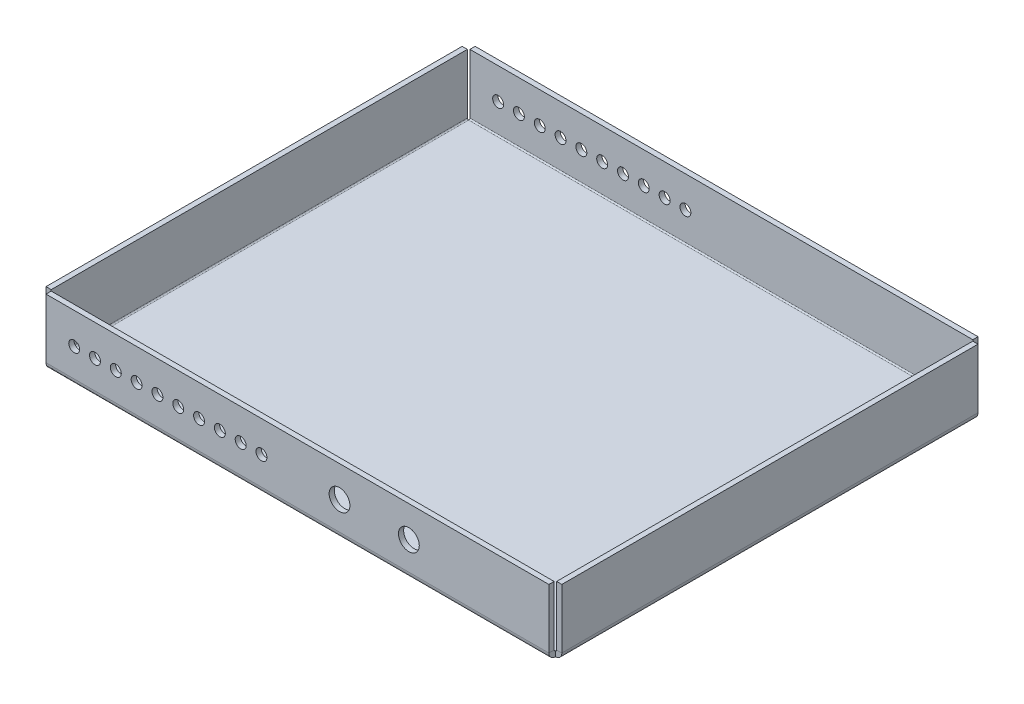
from build123d import *

# Parameters (mm, degrees)
SKETCH15_W         = 290
SKETCH15_H         = 240
BASE_FLANGE1_DEPTH = 3
EDGE_FLANGE1_DEPTH = 240
EDGE_FLANGE2_DEPTH = 290
EDGE_FLANGE3_DEPTH = 240
EDGE_FLANGE4_DEPTH = 290
SKETCH32_R         = 3.15
CUT_EXTRUDE3_DEPTH = 386.680145843
SKETCH33_R         = 6
CUT_EXTRUDE4_DEPTH = 10


# Sheet-metal steps are written as plain solids
with BuildPart() as part:
    # Sketch15 → Base-Flange1 (new body)
    with BuildSketch(Plane(origin=(0, 0, 0), x_dir=(1, 0, 0), z_dir=(0, 1, 0))):
        with Locations((145, 120)):
            Rectangle(SKETCH15_W, SKETCH15_H)
    extrude(amount=-BASE_FLANGE1_DEPTH)

    # Edge-Flange1 section (across the edge) → Edge-Flange1 (add)
    with BuildSketch(Plane(origin=(-0.7366, 0, -240), x_dir=(1, 0, 0), z_dir=(0, 0, 1))):
        with BuildLine():
            Line((-3, 0.7366), (-3, 35))
            Line((-3, 35), (0, 35))
            Line((0, 35), (0, 0.7366))
            ThreePointArc((0, 0.7366), (0.215745145, 0.215745145), (0.7366, 0))
            Line((0.7366, 0), (0.7366, -3))
            ThreePointArc((0.7366, -3), (-1.905575199, -1.905575199), (-3, 0.7366))
        make_face()
    extrude(amount=EDGE_FLANGE1_DEPTH)

    # Edge-Flange2 section (across the edge) → Edge-Flange2 (add)
    with BuildSketch(Plane(origin=(0, 0, 0.7366), x_dir=(0, 0, -1), z_dir=(1, 0, 0))):
        with BuildLine():
            Line((-3, 0.7366), (-3, 35))
            Line((-3, 35), (0, 35))
            Line((0, 35), (0, 0.7366))
            ThreePointArc((0, 0.7366), (0.215745145, 0.215745145), (0.7366, 0))
            Line((0.7366, 0), (0.7366, -3))
            ThreePointArc((0.7366, -3), (-1.905575199, -1.905575199), (-3, 0.7366))
        make_face()
    extrude(amount=EDGE_FLANGE2_DEPTH)

    # Edge-Flange3 section (across the edge) → Edge-Flange3 (add)
    with BuildSketch(Plane(origin=(290.7366, 0, 0), x_dir=(-1, 0, 0), z_dir=(0, 0, -1))):
        with BuildLine():
            Line((-3, 0.7366), (-3, 35))
            Line((-3, 35), (0, 35))
            Line((0, 35), (0, 0.7366))
            ThreePointArc((0, 0.7366), (0.215745145, 0.215745145), (0.7366, 0))
            Line((0.7366, 0), (0.7366, -3))
            ThreePointArc((0.7366, -3), (-1.905575199, -1.905575199), (-3, 0.7366))
        make_face()
    extrude(amount=EDGE_FLANGE3_DEPTH)

    # Edge-Flange4 section (across the edge) → Edge-Flange4 (add)
    with BuildSketch(Plane(origin=(290, 0, -240.7366), x_dir=(0, 0, 1), z_dir=(-1, 0, 0))):
        with BuildLine():
            Line((-3, 0.7366), (-3, 35))
            Line((-3, 35), (0, 35))
            Line((0, 35), (0, 0.7366))
            ThreePointArc((0, 0.7366), (0.215745145, 0.215745145), (0.7366, 0))
            Line((0.7366, 0), (0.7366, -3))
            ThreePointArc((0.7366, -3), (-1.905575199, -1.905575199), (-3, 0.7366))
        make_face()
    extrude(amount=EDGE_FLANGE4_DEPTH)

    # Sketch32 → Cut-Extrude3 (cut, through all)
    with BuildSketch(Plane.XY.offset(3.7366)):
        with Locations((16.2634, 17)):
            Circle(SKETCH32_R)
        with Locations((28.2634, 17)):
            Circle(SKETCH32_R)
        with Locations((40.2634, 17)):
            Circle(SKETCH32_R)
        with Locations((52.2634, 17)):
            Circle(SKETCH32_R)
        with Locations((64.2634, 17)):
            Circle(SKETCH32_R)
        with Locations((76.2634, 17)):
            Circle(SKETCH32_R)
        with Locations((88.2634, 17)):
            Circle(SKETCH32_R)
        with Locations((100.2634, 17)):
            Circle(SKETCH32_R)
        with Locations((112.2634, 17)):
            Circle(SKETCH32_R)
        with Locations((124.2634, 17)):
            Circle(SKETCH32_R)
    extrude(amount=-CUT_EXTRUDE3_DEPTH, mode=Mode.SUBTRACT)

    # Sketch33 → Cut-Extrude4 (cut)
    with BuildSketch(Plane.XY.offset(3.7366)):
        with Locations((169.2634, 17)):
            Circle(SKETCH33_R)
        with Locations((209.2634, 17)):
            Circle(SKETCH33_R)
    extrude(amount=-CUT_EXTRUDE4_DEPTH, mode=Mode.SUBTRACT)


solid = part.part
